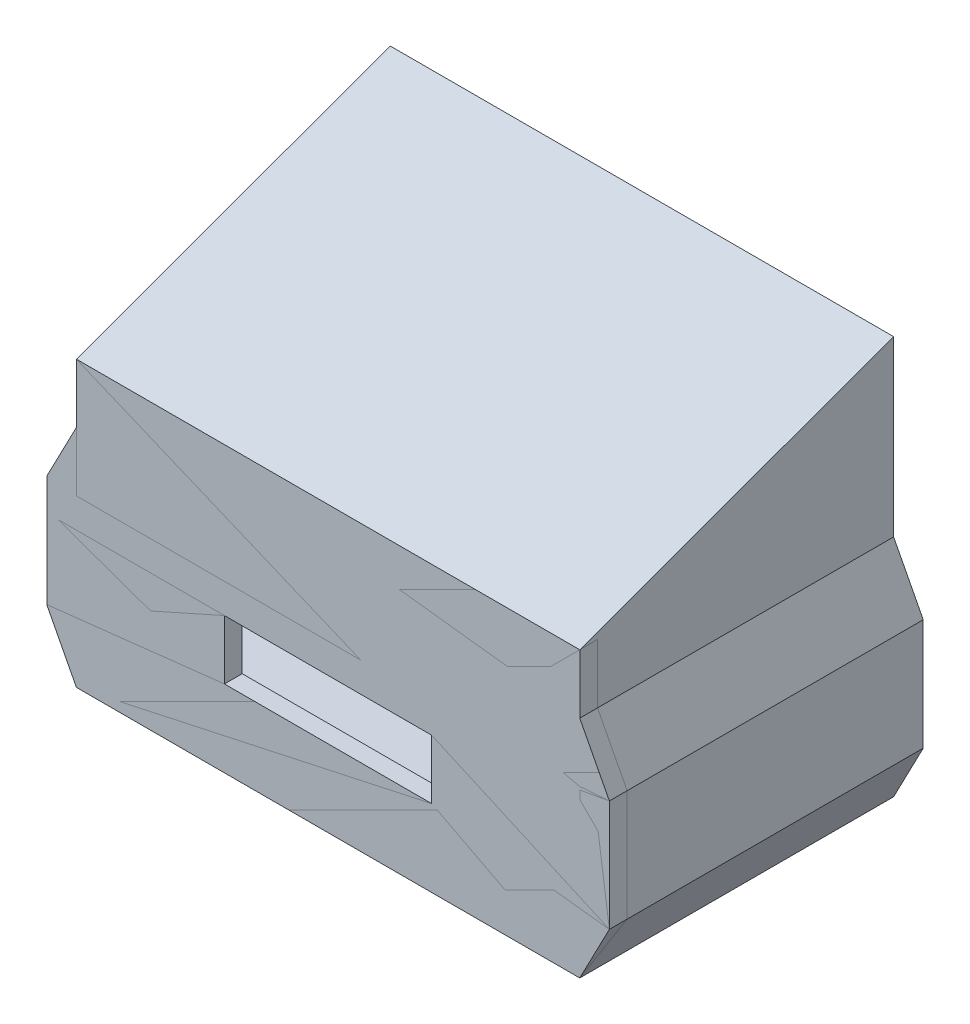
from build123d import *

# Parameters (mm, degrees)
SKETCH1_W                      = 85
SKETCH1_H                      = 93
BOSS_EXTRUDE1_BASE_DEPTH       = 3
BOSS_EXTRUDE4_SIDE_WALLS_DEPTH = 93
CUT_EXTRUDE2_START             = 3
CUT_EXTRUDE2_GUIDE_HOLES_DEPTH = 138.881429411
SKETCH15_W                     = 85
SKETCH15_H                     = 20
BOSS_EXTRUDE9_REAR_WALL_DEPTH  = 3
BOSS_EXTRUDE1_START            = 3
SKETCH17_W                     = 85
SKETCH17_H                     = 3
BOSS_EXTRUDE1_REAR_WALL_DEPTH  = 12
SKETCH30_W                     = 85
SKETCH30_H                     = 2
CUT_EXTRUDE1_REAR_WALL_DEPTH   = 10
BOSS_EXTRUDE2_START            = 25
SKETCH20_W                     = 3
SKETCH20_H                     = 90
BOSS_EXTRUDE2_SIDE_WALL_DEPTH  = 10
CHAMFER1_SIDE_WALL_SIZE        = 3
BOSS_EXTRUDE5_SIDE_WALL_DEPTH  = 50
CHAMFER2_ROOF_SIZE             = 40
CHAMFER2_ROOF_SIZE_2           = 109.899096778
SKETCH28_W                     = 85
SKETCH28_H                     = 102.388734274
BOSS_EXTRUDE7_ROOF_DEPTH       = 2.5
SKETCH29_W                     = 5.082998623
SKETCH29_H                     = 88.705427338
SKETCH29_W_2                   = 8.288926101
SKETCH29_H_2                   = 87.454678394
CUT_EXTRUDE1_CLEAN_UP_DEPTH    = 157.630352173
SKETCH31_W                     = 95
SKETCH31_H                     = 40
CUT_EXTRUDE2_CLEAN_UP_DEPTH    = 154.128366882
BOSS_EXTRUDE1_DEPTH            = 3
SKETCH34_W                     = 35
SKETCH34_H                     = 10
CUT_EXTRUDE1_DEPTH             = 10


# Some blends are built 0.0001 mm under size
with BuildPart() as part:
    # Sketch1 → Boss-Extrude1 _Base (new body)
    with BuildSketch(Plane(origin=(0, 0, 0), x_dir=(1, 0, 0), z_dir=(0, 1, 0))):
        with Locations((42.5, 46.5)):
            Rectangle(SKETCH1_W, SKETCH1_H)
    extrude(amount=BOSS_EXTRUDE1_BASE_DEPTH)

    # Sketch5 → Boss-Extrude4 _Side Walls (add, through all)
    with BuildSketch(Plane.XY):
        Polygon((-5, 28.390936655), (0, 38), (0, 0), (-5, 9.609063345), align=None)
        Polygon((90, 9.609063345), (90, 28.390936655), (85, 38), (85, 0), align=None)
    extrude(amount=-BOSS_EXTRUDE4_SIDE_WALLS_DEPTH)

    # Sketch4 → Cut-Extrude2 _Guide Holes (cut, through all)
    with BuildSketch(Plane.XY.offset(CUT_EXTRUDE2_START)):
        Polygon((-3.1, 23), (0, 26.1), (0, 23), align=None)
        Polygon((85, 23), (88.1, 23), (85, 26.1), align=None)
    extrude(amount=-CUT_EXTRUDE2_GUIDE_HOLES_DEPTH, mode=Mode.SUBTRACT)

    # Sketch15 → Boss-Extrude9 _Rear Wall (add)
    with BuildSketch(Plane.XY):
        with Locations((42.5, 13)):
            Rectangle(SKETCH15_W, SKETCH15_H)
    extrude(amount=-BOSS_EXTRUDE9_REAR_WALL_DEPTH)

    # Sketch17 → Boss-Extrude1 _Rear Wall (add)
    with BuildSketch(Plane(origin=(0, 23, 0), x_dir=(1, 0, 0), z_dir=(0, 1, 0)).offset(BOSS_EXTRUDE1_START)):
        with Locations((42.5, 1.5)):
            Rectangle(SKETCH17_W, SKETCH17_H)
    extrude(amount=BOSS_EXTRUDE1_REAR_WALL_DEPTH)

    # Sketch30 → Cut-Extrude1 _Rear Wall (cut)
    with BuildSketch(Plane.XY):
        with Locations((42.5, 27)):
            Rectangle(SKETCH30_W, SKETCH30_H)
    extrude(amount=-CUT_EXTRUDE1_REAR_WALL_DEPTH, mode=Mode.SUBTRACT)

    # Sketch20 → Boss-Extrude2 _Side Wall (add)
    with BuildSketch(Plane(origin=(0, 3, 0), x_dir=(1, 0, 0), z_dir=(0, 1, 0)).offset(BOSS_EXTRUDE2_START)):
        with Locations((1.5, 48)):
            Rectangle(SKETCH20_W, SKETCH20_H)
        with Locations((83.5, 48)):
            Rectangle(SKETCH20_W, SKETCH20_H)
    extrude(amount=BOSS_EXTRUDE2_SIDE_WALL_DEPTH)

    # Chamfer1 _Side Wall
    chamfer1_side_wall_edges = [part.edges().sort_by_distance(p)[0] for p in [
        (82, 28, -48),
        (3, 28, -48),
    ]]
    chamfer(chamfer1_side_wall_edges, length=CHAMFER1_SIDE_WALL_SIZE - 0.0001)  # a hair under: the kernel refuses the full size

    # Sketch26 → Boss-Extrude5 _Side Wall (add)
    with BuildSketch(Plane(origin=(0, 38, 0), x_dir=(1, 0, 0), z_dir=(0, 1, 0))):
        Polygon((0, 0), (0, 93), (3, 93), (3, 3), (82, 3), (82, 93), (85, 93), (85, 0), align=None)
    extrude(amount=BOSS_EXTRUDE5_SIDE_WALL_DEPTH)

    # Chamfer2 _Roof
    # the kernel refuses this chamfer: 109.899096778, 40 mm, written as the material it takes off along each edge
    with BuildSketch(Plane(origin=(370.099657974, 88, 0), x_dir=(0, -0.9950833631817486, 0.09904090225205059), z_dir=(-1, 0, 0))) as chamfer2_roof_piece_1:
        Polygon((CHAMFER2_ROOF_SIZE * 0.995083363182, -CHAMFER2_ROOF_SIZE * 0.0990409022521), (-CHAMFER2_ROOF_SIZE_2 * 0.0990409022522, -CHAMFER2_ROOF_SIZE_2 * 0.995083363183), (0, 0), align=None)
    extrude(amount=655.199315948, mode=Mode.SUBTRACT)

    # Sketch28 → Boss-Extrude7 _Roof (add)
    with BuildSketch(Plane(origin=(0, 42.385066635, 15.426902632), x_dir=(1, 0, 0), z_dir=(0, 0.9396926207859096, 0.34202014332566505))):
        with Locations((42.5, 64.191132583)):
            Rectangle(SKETCH28_W, SKETCH28_H)
    extrude(amount=-BOSS_EXTRUDE7_ROOF_DEPTH)

    # Sketch29 → Cut-Extrude1 _Clean up (cut, through all)
    with BuildSketch(Plane(origin=(90, 0, 0), x_dir=(0, 0, -1), z_dir=(1, 0, 0))):
        with Locations((95.541499312, 44.352713669)):
            Rectangle(SKETCH29_W, SKETCH29_H)
        with Locations((-4.144463051, 43.727339197)):
            Rectangle(SKETCH29_W_2, SKETCH29_H_2)
    extrude(amount=-CUT_EXTRUDE1_CLEAN_UP_DEPTH, mode=Mode.SUBTRACT)

    # Sketch31 → Cut-Extrude2 _Clean Up (cut, through all)
    with BuildSketch(Plane.XZ):
        with Locations((42.5, -73)):
            Rectangle(SKETCH31_W, SKETCH31_H)
    extrude(amount=-CUT_EXTRUDE2_CLEAN_UP_DEPTH, mode=Mode.SUBTRACT)


with BuildPart() as body_2:
    # Sketch33 → Boss-Extrude1 (new body)
    with BuildSketch(Plane.XY):
        Polygon((0, 38), (0, 48), (85, 48), (85, 38), (90, 28.390936655), (90, 9.609063345), (85, 0), (0, 0), (-5, 9.609063345), (-5, 28.390936655), align=None)
    extrude(amount=-BOSS_EXTRUDE1_DEPTH)


with BuildPart() as cut_extrude1_tool:
    # Sketch34 → Cut-Extrude1 (new body)
    with BuildSketch(Plane.XY):
        with Locations((42.5, 18)):
            Rectangle(SKETCH34_W, SKETCH34_H)
    extrude(amount=-CUT_EXTRUDE1_DEPTH)


with BuildPart() as part_1:
    add(part.part)

    # Cut-Extrude1: cut by cut_extrude1_tool
    add(cut_extrude1_tool.part, mode=Mode.SUBTRACT)


with BuildPart() as body_2_1:
    add(body_2.part)

    # Cut-Extrude1: cut by cut_extrude1_tool
    add(cut_extrude1_tool.part, mode=Mode.SUBTRACT)


solid = Compound([part_1.part, body_2_1.part])
